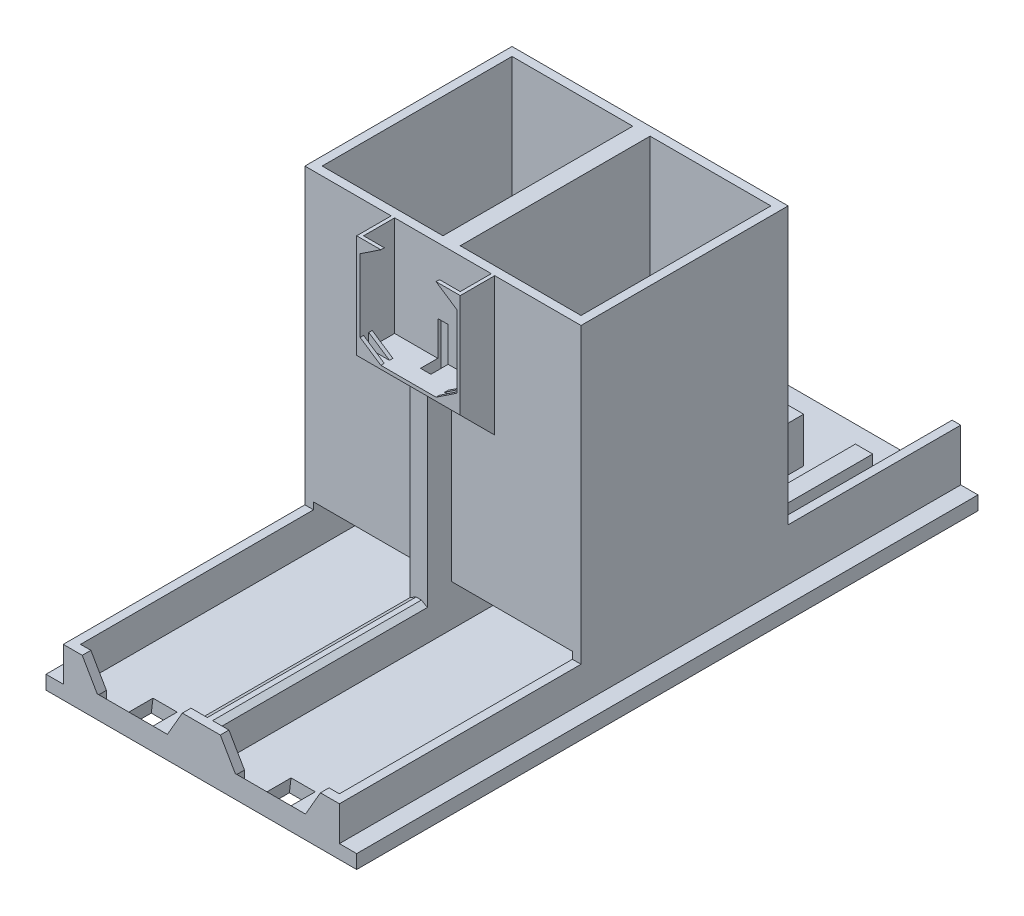
from build123d import *
from OCP.BRepFilletAPI import BRepFilletAPI_MakeChamfer

# Parameters (mm, degrees)
SKETCH1_W                                   = 80
SKETCH1_H                                   = 60
BOSS_EXTRUDE1_DEPTH                         = 100
CUT_EXTRUDE1_START                          = 5
SKETCH2_W                                   = 35
SKETCH2_H                                   = 55
CUT_EXTRUDE1_DEPTH                          = 95
SKETCH3_W                                   = 80
SKETCH3_H                                   = 5
BOSS_EXTRUDE2_DEPTH                         = 70
BOSS_EXTRUDE3_DEPTH                         = 10
SKETCH5_W                                   = 20
SKETCH5_H                                   = 2.5
CUT_EXTRUDE2_DEPTH                          = 7.5
SKETCH6_W                                   = 35
SKETCH6_H                                   = 12
CUT_EXTRUDE4_DEPTH                          = 57.5
CUT_EXTRUDE6_REACH                          = 184.483
SKETCH7_R                                   = 4
SKETCH9_W                                   = 80
SKETCH9_H                                   = 50
BOSS_EXTRUDE4_DEPTH                         = 5
SKETCH13_W                                  = 8
SKETCH13_H                                  = 7
CUT_EXTRUDE8_BUTTON_HOLES_DEPTH             = 166.90660023
BOSS_EXTRUDE5_OLED_MOUNT_DEPTH              = 10
BOSS_EXTRUDE6_OLED_MOUNT_DEPTH              = 1
BOSS_EXTRUDE7_START                         = -2.5
BOSS_EXTRUDE7_OLED_MOUNT_DEPTH              = 1
BOSS_EXTRUDE8_OLED_MOUNT_DEPTH              = 1
BOSS_EXTRUDE13_OLED_MOUNT_SUPPORT_DEPTH     = 30
CUT_EXTRUDE9_OLED_CABLE_DEPTH               = 10
CUT_EXTRUDE9_OLED_CABLE_DEPTH_BACK          = 154.430766146
SKETCH18_W                                  = 3
SKETCH18_H                                  = 6
BOSS_EXTRUDE12_OLED_CABLE_GUIDE_REACH       = 162.39
SKETCH20_W                                  = 5
SKETCH20_H                                  = 5
CUT_EXTRUDE10_SOLENOID_WIRE_HOLE_DEPTH      = 166.90660023
SKETCH21_W                                  = 5
SKETCH21_H                                  = 32
BOSS_EXTRUDE9_SOLENOID_SIDE_SUPPORT_DEPTH   = 13
SKETCH27_W                                  = 2.5
SKETCH27_H                                  = 50
BOSS_EXTRUDE13_SOLENOID_SECTION_WALLS_DEPTH = 15
SKETCH29_W                                  = 180
SKETCH29_H                                  = 5
BOSS_EXTRUDE9_GUIDE_DEPTH                   = 5
BOSS_EXTRUDE10_START                        = -80
SKETCH29_3_W                                = 180
SKETCH29_3_H                                = 5
BOSS_EXTRUDE10_GUIDE_DEPTH                  = 5
SKETCH33_W                                  = 90
SKETCH33_H                                  = 180
CUT_EXTRUDE7_SLIM_BASE_DEPTH                = 1
BOSS_EXTRUDE5_REACH                         = 217.163
CHAMFER3_THUMB_SIZE                         = 2.5
CHAMFER5_THUMB_SIZE                         = 4.5
CHAMFER5_THUMB_SIZE2                        = 7.794228634
CHAMFER5_THUMB_PART_2_SIZE                  = 4.5
CHAMFER5_THUMB_PART_2_SIZE2                 = 7.794228634
CHAMFER5_THUMB_PART_3_SIZE                  = 4.5
CHAMFER5_THUMB_PART_3_SIZE2                 = 7.794228634
CHAMFER6_SIZE                               = 1
CHAMFER6_SIZE2                              = 1.732050808


with BuildPart() as part:
    # Sketch1 → Boss-Extrude1 (new body)
    with BuildSketch(Plane(origin=(0, 0, 0), x_dir=(1, 0, 0), z_dir=(0, 1, 0))):
        with Locations((40, 30)):
            Rectangle(SKETCH1_W, SKETCH1_H)
    extrude(amount=BOSS_EXTRUDE1_DEPTH)

    # Sketch2 → Cut-Extrude1 (cut)
    with BuildSketch(Plane(origin=(0, 0, 0), x_dir=(1, 0, 0), z_dir=(0, 1, 0)).offset(CUT_EXTRUDE1_START)):
        with Locations((20, 30)):
            Rectangle(SKETCH2_W, SKETCH2_H)
        with Locations((60, 30)):
            Rectangle(SKETCH2_W, SKETCH2_H)
    extrude(amount=CUT_EXTRUDE1_DEPTH, mode=Mode.SUBTRACT)

    # Sketch3 → Boss-Extrude2 (add)
    with BuildSketch(Plane.XY):
        with Locations((40, 2.5)):
            Rectangle(SKETCH3_W, SKETCH3_H)
    extrude(amount=BOSS_EXTRUDE2_DEPTH)

    # Sketch4 → Boss-Extrude3 (add)
    with BuildSketch(Plane(origin=(0, 5, 0), x_dir=(1, 0, 0), z_dir=(0, 1, 0))):
        Polygon((80, 0), (77.5, 0), (77.5, -67.5), (42.5, -67.5), (42.5, 0), (37.5, 0), (37.5, -67.5), (2.5, -67.5), (2.5, 0), (0, 0), (0, -70), (80, -70), align=None)
    extrude(amount=BOSS_EXTRUDE3_DEPTH)

    # Sketch5 → Cut-Extrude2 (cut)
    with BuildSketch(Plane(origin=(0, 15, 0), x_dir=(1, 0, 0), z_dir=(0, 1, 0))):
        with Locations((20, -68.75)):
            Rectangle(SKETCH5_W, SKETCH5_H)
        with Locations((60, -68.75)):
            Rectangle(SKETCH5_W, SKETCH5_H)
    extrude(amount=-CUT_EXTRUDE2_DEPTH, mode=Mode.SUBTRACT)

    # Sketch6 → Cut-Extrude4 (cut)
    with BuildSketch(Plane.XY):
        with Locations((20, 11)):
            Rectangle(SKETCH6_W, SKETCH6_H)
        with Locations((60, 11)):
            Rectangle(SKETCH6_W, SKETCH6_H)
    extrude(amount=-CUT_EXTRUDE4_DEPTH, mode=Mode.SUBTRACT)

    # Sketch7 → Cut-Extrude6 (cut, up to next)
    with BuildSketch(Plane(origin=(0, 0, -60), x_dir=(-1, 0, 0), z_dir=(0, 0, -1)), mode=Mode.PRIVATE) as cut_extrude6_sk1:
        with Locations((-20, 11.5)):
            Circle(SKETCH7_R)
    cut_extrude6_tool1 = extrude(cut_extrude6_sk1.sketch, amount=-CUT_EXTRUDE6_REACH, mode=Mode.PRIVATE) & part.part
    # Sketch7 → Cut-Extrude6 (cut, up to next)
    with BuildSketch(Plane(origin=(0, 0, -60), x_dir=(-1, 0, 0), z_dir=(0, 0, -1)), mode=Mode.PRIVATE) as cut_extrude6_sk2:
        with Locations((-60, 11.5)):
            Circle(SKETCH7_R)
    cut_extrude6_tool2 = extrude(cut_extrude6_sk2.sketch, amount=-CUT_EXTRUDE6_REACH, mode=Mode.PRIVATE) & part.part
    add(cut_extrude6_tool1.solids().sort_by_distance((20, 11.5, -60))[0], mode=Mode.SUBTRACT)
    add(cut_extrude6_tool2.solids().sort_by_distance((60, 11.5, -60))[0], mode=Mode.SUBTRACT)

    # Sketch9 → Boss-Extrude4 (add)
    with BuildSketch(Plane(origin=(0, 0, 0), x_dir=(1, 0, 0), z_dir=(0, 1, 0))):
        with Locations((40, 85)):
            Rectangle(SKETCH9_W, SKETCH9_H)
    extrude(amount=BOSS_EXTRUDE4_DEPTH)

    # Sketch13 → Cut-Extrude8 _Button Holes (cut, through all)
    with BuildSketch(Plane(origin=(0, 5, 0), x_dir=(1, 0, 0), z_dir=(0, 1, 0))):
        with Locations((20, -64)):
            Rectangle(SKETCH13_W, SKETCH13_H)
        with Locations((60, -64)):
            Rectangle(SKETCH13_W, SKETCH13_H)
    extrude(amount=-CUT_EXTRUDE8_BUTTON_HOLES_DEPTH, mode=Mode.SUBTRACT)

    # Sketch14 → Boss-Extrude5 _OLED Mount (add)
    with BuildSketch(Plane.XY):
        Polygon((25, 100), (26, 100), (26, 71), (54, 71), (54, 100), (55, 100), (55, 70), (54, 70), (26, 70), (25, 70), align=None)
    extrude(amount=BOSS_EXTRUDE5_OLED_MOUNT_DEPTH)

    # Sketch15 → Boss-Extrude6 _OLED Mount (add)
    with BuildSketch(Plane.XY.offset(10)):
        Polygon((26, 71), (32, 71), (26, 75), align=None)
        Polygon((54, 75), (54, 71), (48, 71), align=None)
    extrude(amount=-BOSS_EXTRUDE6_OLED_MOUNT_DEPTH)

    # Sketch15_2 → Boss-Extrude7 _OLED Mount (add)
    with BuildSketch(Plane.XY.offset(10).offset(BOSS_EXTRUDE7_START)):
        Polygon((26, 71), (32, 71), (26, 75), align=None)
        Polygon((54, 75), (54, 71), (48, 71), align=None)
    extrude(amount=-BOSS_EXTRUDE7_OLED_MOUNT_DEPTH)

    # Sketch17 → Boss-Extrude8 _OLED Mount (add)
    with BuildSketch(Plane.XY.offset(10)):
        Polygon((54, 96), (54, 100), (48, 100), align=None)
        Polygon((26, 100), (32, 100), (26, 96), align=None)
    extrude(amount=-BOSS_EXTRUDE8_OLED_MOUNT_DEPTH)

    # Sketch32 → Boss-Extrude13 OLED Mount Support (add)
    with BuildSketch(Plane.ZY.offset(-25)):
        Polygon((0, 70), (10, 70), (0, 60), align=None)
    extrude(amount=-BOSS_EXTRUDE13_OLED_MOUNT_SUPPORT_DEPTH)

    # Sketch18 → Cut-Extrude9 _OLED Cable (cut, two sides: drawn at the far end of the back side and taken through both)
    with BuildSketch(Plane(origin=(0, 71, 0), x_dir=(1, 0, 0), z_dir=(0, 1, 0)).offset(-CUT_EXTRUDE9_OLED_CABLE_DEPTH_BACK)):
        with Locations((40, -2)):
            Rectangle(SKETCH18_W, SKETCH18_H)
    extrude(amount=CUT_EXTRUDE9_OLED_CABLE_DEPTH + CUT_EXTRUDE9_OLED_CABLE_DEPTH_BACK, mode=Mode.SUBTRACT)

    # Boss-Extrude12 _OLED Cable Guide: up to this plane
    boss_extrude12_oled_cable_guide_end = Plane(origin=(55, 70, 10), z_dir=(0, -0.7071067811865477, 0.7071067811865474))
    # Sketch31 → Boss-Extrude12 _OLED Cable Guide (add, up to the surface)
    with BuildSketch(Plane(origin=(0, 15, 0), x_dir=(1, 0, 0), z_dir=(0, 1, 0)), mode=Mode.PRIVATE) as boss_extrude12_oled_cable_guide_sk1:
        Polygon((37.5, 0), (38.5, 0), (38.5, -5), (41.5, -5), (41.5, 0), (42.5, 0), (42.5, -7), (37.5, -7), align=None)
    boss_extrude12_oled_cable_guide_tool1 = split(extrude(boss_extrude12_oled_cable_guide_sk1.sketch, amount=BOSS_EXTRUDE12_OLED_CABLE_GUIDE_REACH, mode=Mode.PRIVATE), bisect_by=boss_extrude12_oled_cable_guide_end, keep=Keep.BOTH, mode=Mode.PRIVATE)
    add(boss_extrude12_oled_cable_guide_tool1.solids().sort_by_distance((38, 15, 0.086023))[0])

    # Sketch20 → Cut-Extrude10 _Solenoid Wire Hole (cut, through all)
    with BuildSketch(Plane(origin=(0, 5, 0), x_dir=(1, 0, 0), z_dir=(0, 1, 0))):
        with Locations((60, 62.5)):
            Rectangle(SKETCH20_W, SKETCH20_H)
        with Locations((20, 62.5)):
            Rectangle(SKETCH20_W, SKETCH20_H)
    extrude(amount=-CUT_EXTRUDE10_SOLENOID_WIRE_HOLE_DEPTH, mode=Mode.SUBTRACT)

    # Sketch21 → Boss-Extrude9 _Solenoid Side Support (add)
    with BuildSketch(Plane(origin=(0, 5, 0), x_dir=(1, 0, 0), z_dir=(0, 1, 0))):
        with Locations((70, 76)):
            Rectangle(SKETCH21_W, SKETCH21_H)
        with Locations((50, 76)):
            Rectangle(SKETCH21_W, SKETCH21_H)
        with Locations((30, 76)):
            Rectangle(SKETCH21_W, SKETCH21_H)
        with Locations((10, 76)):
            Rectangle(SKETCH21_W, SKETCH21_H)
    extrude(amount=BOSS_EXTRUDE9_SOLENOID_SIDE_SUPPORT_DEPTH)

    # Sketch27 → Boss-Extrude13 _Solenoid Section Walls (add)
    with BuildSketch(Plane(origin=(0, 5, 0), x_dir=(1, 0, 0), z_dir=(0, 1, 0))):
        with Locations((78.75, 85)):
            Rectangle(SKETCH27_W, SKETCH27_H)
        with Locations((1.25, 85)):
            Rectangle(SKETCH27_W, SKETCH27_H)
    extrude(amount=BOSS_EXTRUDE13_SOLENOID_SECTION_WALLS_DEPTH)

    # Sketch29 → Boss-Extrude9 _Guide (add)
    with BuildSketch(Plane(origin=(80, 0, 0), x_dir=(0, 0, -1), z_dir=(1, 0, 0))):
        with Locations((20, 2.5)):
            Rectangle(SKETCH29_W, SKETCH29_H)
    extrude(amount=BOSS_EXTRUDE9_GUIDE_DEPTH)

    # Sketch29_3 → Boss-Extrude10 _Guide (add)
    with BuildSketch(Plane(origin=(80, 0, 0), x_dir=(0, 0, -1), z_dir=(1, 0, 0)).offset(BOSS_EXTRUDE10_START)):
        with Locations((20, 2.5)):
            Rectangle(SKETCH29_3_W, SKETCH29_3_H)
    extrude(amount=-BOSS_EXTRUDE10_GUIDE_DEPTH)

    # Sketch33 → Cut-Extrude7 _Slim Base (cut)
    with BuildSketch(Plane.XZ):
        with Locations((40, -20)):
            Rectangle(SKETCH33_W, SKETCH33_H)
    extrude(amount=-CUT_EXTRUDE7_SLIM_BASE_DEPTH, mode=Mode.SUBTRACT)

    # Sketch34 → Boss-Extrude5 (add, up to next)
    with BuildSketch(Plane.XY.offset(60.5), mode=Mode.PRIVATE) as boss_extrude5_sk1:
        Polygon((16, 5), (16.5, 5), (16, 1), align=None)
    boss_extrude5_tool1 = extrude(boss_extrude5_sk1.sketch, amount=BOSS_EXTRUDE5_REACH, mode=Mode.PRIVATE) - part.part
    # Sketch34 → Boss-Extrude5 (add, up to next)
    with BuildSketch(Plane.XY.offset(60.5), mode=Mode.PRIVATE) as boss_extrude5_sk2:
        Polygon((24, 5), (24, 1), (23.5, 5), align=None)
    boss_extrude5_tool2 = extrude(boss_extrude5_sk2.sketch, amount=BOSS_EXTRUDE5_REACH, mode=Mode.PRIVATE) - part.part
    # Sketch34 → Boss-Extrude5 (add, up to next)
    with BuildSketch(Plane.XY.offset(60.5), mode=Mode.PRIVATE) as boss_extrude5_sk3:
        Polygon((56.5, 5), (56, 5), (56, 1), align=None)
    boss_extrude5_tool3 = extrude(boss_extrude5_sk3.sketch, amount=BOSS_EXTRUDE5_REACH, mode=Mode.PRIVATE) - part.part
    # Sketch34 → Boss-Extrude5 (add, up to next)
    with BuildSketch(Plane.XY.offset(60.5), mode=Mode.PRIVATE) as boss_extrude5_sk4:
        Polygon((64, 1), (64, 5), (63.5, 5), align=None)
    boss_extrude5_tool4 = extrude(boss_extrude5_sk4.sketch, amount=BOSS_EXTRUDE5_REACH, mode=Mode.PRIVATE) - part.part
    add(boss_extrude5_tool1.solids().sort_by_distance((16.166667, 3.666667, 60.5))[0])
    add(boss_extrude5_tool2.solids().sort_by_distance((23.833333, 3.666667, 60.5))[0])
    add(boss_extrude5_tool3.solids().sort_by_distance((56.166667, 3.666667, 60.5))[0])
    add(boss_extrude5_tool4.solids().sort_by_distance((63.833333, 3.666667, 60.5))[0])

    # Chamfer3 _Thumb
    chamfer3_thumb_edges = [part.edges().sort_by_distance(p)[0] for p in [
        (20, 7.5, 67.5),
        (60, 7.5, 67.5),
    ]]
    chamfer(chamfer3_thumb_edges, length=CHAMFER3_THUMB_SIZE - 0.0001)  # a hair under: the kernel refuses the full size

    # Chamfer5 _Thumb
    chamfer5_thumb_edges = [part.edges().sort_by_distance(p)[0] for p in [
        (70, 15, 68.75),
    ]]
    chamfer5_thumb_side = [part.faces().sort_by_distance(p)[0] for p in [
        (78.266129032, 15, 38.266129032),
    ]]
    chamfer(chamfer5_thumb_edges, length=CHAMFER5_THUMB_SIZE, length2=CHAMFER5_THUMB_SIZE2, reference=chamfer5_thumb_side[0])

    # Chamfer5 _Thumb part 2
    chamfer5_thumb_part_2_edges = [part.edges().sort_by_distance(p)[0] for p in [
        (50, 15, 68.75),
        (30, 15, 68.75),
    ]]
    chamfer5_thumb_part_2_side = [part.faces().sort_by_distance(p)[0] for p in [
        (40, 15, 41.718085106),
    ]]
    chamfer(chamfer5_thumb_part_2_edges, length=CHAMFER5_THUMB_PART_2_SIZE, length2=CHAMFER5_THUMB_PART_2_SIZE2, reference=chamfer5_thumb_part_2_side[0])

    # Chamfer5 _Thumb part 3
    chamfer5_thumb_part_3_edges = [part.edges().sort_by_distance(p)[0] for p in [
        (10, 15, 68.75),
    ]]
    chamfer5_thumb_part_3_side = [part.faces().sort_by_distance(p)[0] for p in [
        (1.733870968, 15, 38.266129032),
    ]]
    chamfer(chamfer5_thumb_part_3_edges, length=CHAMFER5_THUMB_PART_3_SIZE, length2=CHAMFER5_THUMB_PART_3_SIZE2, reference=chamfer5_thumb_part_3_side[0])

    # Chamfer6: one chamfer whose edges measure the first distance from different faces: ONE call of the kernel's chamfer builder (chamfer() names one face for all edges)
    chamfer6_edges_1 = [part.edges().sort_by_distance(p)[0] for p in [
        (37.5, 15, 37.25),
    ]]
    chamfer6_side_1 = [part.faces().sort_by_distance(p)[0] for p in [
        (37.5, 47.010473988, -21.180224367),
    ]]
    chamfer6_edges_2 = [part.edges().sort_by_distance(p)[0] for p in [
        (42.5, 15, 37.25),
    ]]
    chamfer6_side_2 = [part.faces().sort_by_distance(p)[0] for p in [
        (42.5, 47.010473988, -21.180224367),
    ]]
    chamfer6 = BRepFilletAPI_MakeChamfer(part.part.solid().wrapped)
    for e in chamfer6_edges_1:
        chamfer6.Add(CHAMFER6_SIZE, CHAMFER6_SIZE2, e.wrapped, chamfer6_side_1[0].wrapped)  # the first distance lies on this face
    for e in chamfer6_edges_2:
        chamfer6.Add(CHAMFER6_SIZE, CHAMFER6_SIZE2, e.wrapped, chamfer6_side_2[0].wrapped)  # the first distance lies on this face
    add(Compound.cast(chamfer6.Shape()), mode=Mode.REPLACE)


solid = part.part
